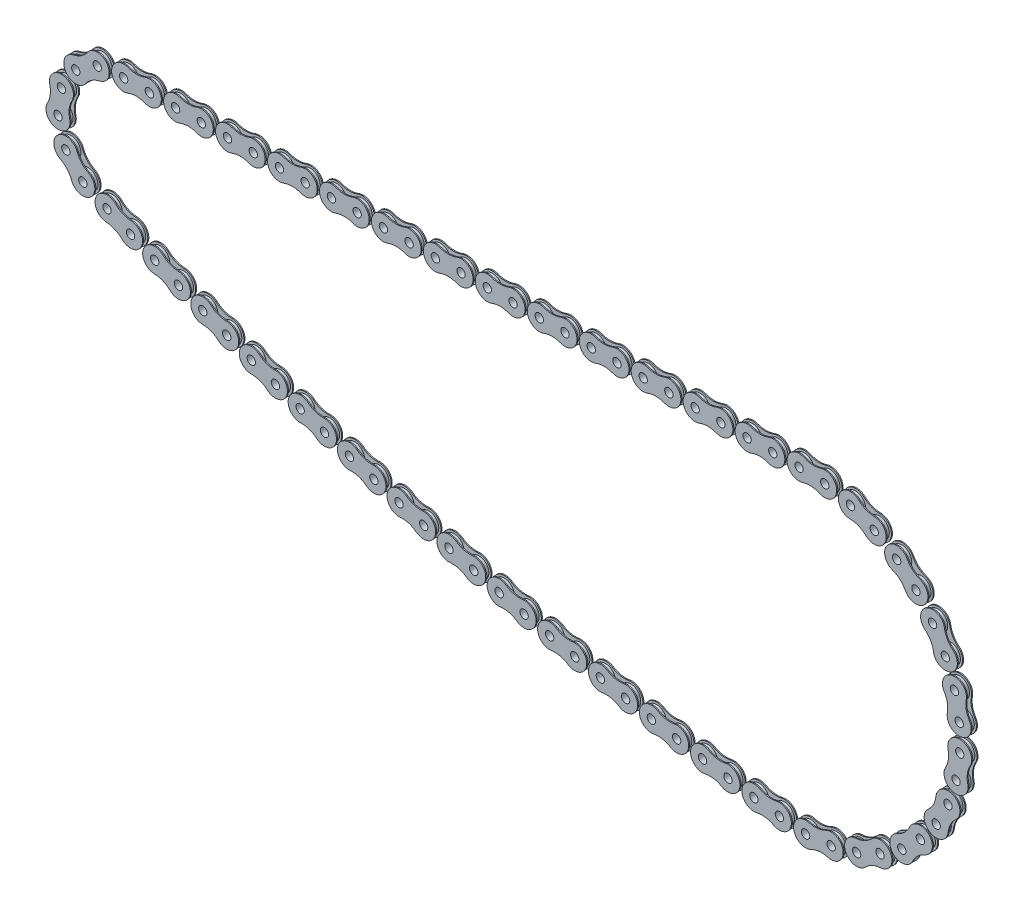
from build123d import *

# Parameters (mm, degrees)
SKETCH1_R             = 4.75
SKETCH1_R_2           = 2
BOSS_EXTRUDE1_DEPTH   = 1
BOSS_EXTRUDE1_2_DEPTH = 1
SKETCH2_R             = 2
BOSS_EXTRUDE2_DEPTH   = 0.5
BOSS_EXTRUDE3_START   = -2.5
SKETCH2_3_R           = 2
BOSS_EXTRUDE3_DEPTH   = 0.5
CRVPATTERN1_5_ANGLE   = 3.3194027
CRVPATTERN1_6_ANGLE   = 22.3179326
CRVPATTERN1_7_ANGLE   = 41.3164626
CRVPATTERN1_8_ANGLE   = 60.3149926
CRVPATTERN1_9_ANGLE   = 79.3135226
CRVPATTERN1_10_ANGLE  = 98.3120525
CRVPATTERN1_11_ANGLE  = 117.3105825
CRVPATTERN1_12_ANGLE  = 136.3091125
CRVPATTERN1_13_ANGLE  = 155.3076425
CRVPATTERN1_14_ANGLE  = 174.3061724
CRVPATTERN1_15_ANGLE  = 172.2361813
CRVPATTERN1_16_ANGLE  = 171.002959
CRVPATTERN1_17_ANGLE  = 169.7697367
CRVPATTERN1_18_ANGLE  = 168.5365143
CRVPATTERN1_19_ANGLE  = 167.303292
CRVPATTERN1_20_ANGLE  = 166.0700697
CRVPATTERN1_21_ANGLE  = 164.8368473
CRVPATTERN1_22_ANGLE  = 163.603625
CRVPATTERN1_23_ANGLE  = 162.3704027
CRVPATTERN1_24_ANGLE  = 161.1371803
CRVPATTERN1_25_ANGLE  = 159.903958
CRVPATTERN1_26_ANGLE  = 158.6707357
CRVPATTERN1_27_ANGLE  = 157.4375133
CRVPATTERN1_28_ANGLE  = 156.204291
CRVPATTERN1_29_ANGLE  = 131.3399051
CRVPATTERN1_30_ANGLE  = 82.3746217
CRVPATTERN1_31_ANGLE  = 33.4093382


with BuildPart() as part:
    # Sketch1 → Boss-Extrude1 (new, symmetric)
    with BuildSketch(Plane.XY):
        with Locations((-6.15, 0)):
            Circle(SKETCH1_R)
        with Locations((-6.15, 0)):
            Circle(SKETCH1_R_2, mode=Mode.SUBTRACT)
    extrude(amount=BOSS_EXTRUDE1_DEPTH, both=True)



with BuildPart() as body_2:
    # Sketch1 → Boss-Extrude1 2 (new, symmetric)
    with BuildSketch(Plane.XY):
        with Locations(Location((6.15, 0, 0), (0, 0, 180))):
            Circle(SKETCH1_R)
        with Locations(Location((6.15, 0, 0), (0, 0, 180))):
            Circle(SKETCH1_R_2, mode=Mode.SUBTRACT)
    extrude(amount=BOSS_EXTRUDE1_2_DEPTH, both=True)


with BuildPart() as part_1:
    add(part.part)

    add(body_2.part)  # Boss-Extrude2 merges body 2
    # Sketch2 → Boss-Extrude2 (add)
    with BuildSketch(Plane.XY.offset(1)):
        with BuildLine():
            ThreePointArc((-4.059362766, 5.356466742), (-11.9, 0), (-4.059362766, -5.356466742))
            ThreePointArc((-4.059362766, -5.356466742), (0, -4.592348401), (4.059362766, -5.356466742))
            ThreePointArc((4.059362766, -5.356466742), (11.9, 0), (4.059362766, 5.356466742))
            ThreePointArc((4.059362766, 5.356466742), (0, 4.592348401), (-4.059362766, 5.356466742))
        make_face()
        with Locations((-6.15, 0)):
            Circle(SKETCH2_R, mode=Mode.SUBTRACT)
        with Locations(Location((6.15, 0, 0), (0, 0, 180))):
            Circle(SKETCH2_R, mode=Mode.SUBTRACT)
    extrude(amount=BOSS_EXTRUDE2_DEPTH)

    # Sketch2<3> → Boss-Extrude3 (add)
    with BuildSketch(Plane.XY.offset(1).offset(BOSS_EXTRUDE3_START)):
        with BuildLine():
            ThreePointArc((-4.059362766, 5.356466742), (-11.9, 0), (-4.059362766, -5.356466742))
            ThreePointArc((-4.059362766, -5.356466742), (0, -4.592348401), (4.059362766, -5.356466742))
            ThreePointArc((4.059362766, -5.356466742), (11.9, 0), (4.059362766, 5.356466742))
            ThreePointArc((4.059362766, 5.356466742), (0, 4.592348401), (-4.059362766, 5.356466742))
        make_face()
        with Locations((-6.15, 0)):
            Circle(SKETCH2_3_R, mode=Mode.SUBTRACT)
        with Locations((6.15, 0)):
            Circle(SKETCH2_3_R, mode=Mode.SUBTRACT)
    extrude(amount=BOSS_EXTRUDE3_DEPTH)


with BuildPart() as body_2_2:
    # CrvPattern1: read off the stored shape, not the designer's step
    # CrvPattern1: copy of part
    add(part_1.part.moved(Location((24.8690176, 0, 0))))


with BuildPart() as body_3:
    # CrvPattern1 2: copy of part
    add(part_1.part.moved(Location((49.7380352, 0, 0))))


with BuildPart() as body_4:
    # CrvPattern1 3: copy of part
    add(part_1.part.moved(Location((74.6070527, 0, 0))))


with BuildPart() as body_5:
    # CrvPattern1 4: copy of part
    add(part_1.part.moved(Location((99.4760703, 0, 0))))


with BuildPart() as body_6:
    # CrvPattern1 5: copy of part
    add(part_1.part.moved(Location((124.1413296, 7.0740823, 0))).rotate(Axis((0, 0, 0), (0, 0, -1)), CRVPATTERN1_5_ANGLE))


with BuildPart() as body_7:
    # CrvPattern1 6: copy of part
    add(part_1.part.moved(Location((139.4918379, 51.1876677, 0))).rotate(Axis((0, 0, 0), (0, 0, -1)), CRVPATTERN1_6_ANGLE))


with BuildPart() as body_8:
    # CrvPattern1 7: copy of part
    add(part_1.part.moved(Location((139.6452484, 97.8955149, 0))).rotate(Axis((0, 0, 0), (0, 0, -1)), CRVPATTERN1_7_ANGLE))


with BuildPart() as body_9:
    # CrvPattern1 8: copy of part
    add(part_1.part.moved(Location((124.5848477, 142.108984, 0))).rotate(Axis((0, 0, 0), (0, 0, -1)), CRVPATTERN1_8_ANGLE))


with BuildPart() as body_10:
    # CrvPattern1 9: copy of part
    add(part_1.part.moved(Location((95.9514083, 179.0111881, 0))).rotate(Axis((0, 0, 0), (0, 0, -1)), CRVPATTERN1_9_ANGLE))


with BuildPart() as body_11:
    # CrvPattern1 10: copy of part
    add(part_1.part.moved(Location((56.864433, 204.5817744, 0))).rotate(Axis((0, 0, 0), (0, 0, -1)), CRVPATTERN1_10_ANGLE))


with BuildPart() as body_12:
    # CrvPattern1 11: copy of part
    add(part_1.part.moved(Location((11.582297, 216.0349262, 0))).rotate(Axis((0, 0, 0), (0, 0, -1)), CRVPATTERN1_11_ANGLE))


with BuildPart() as body_13:
    # CrvPattern1 12: copy of part
    add(part_1.part.moved(Location((-34.9616855, 212.1228666, 0))).rotate(Axis((0, 0, 0), (0, 0, -1)), CRVPATTERN1_12_ANGLE))


with BuildPart() as body_14:
    # CrvPattern1 13: copy of part
    add(part_1.part.moved(Location((-77.6967273, 193.2717996, 0))).rotate(Axis((0, 0, 0), (0, 0, -1)), CRVPATTERN1_13_ANGLE))


with BuildPart() as body_15:
    # CrvPattern1 14: copy of part
    add(part_1.part.moved(Location((-111.9670102, 161.5354761, 0))).rotate(Axis((0, 0, 0), (0, 0, -1)), CRVPATTERN1_14_ANGLE))


with BuildPart() as body_16:
    # CrvPattern1 15: copy of part
    add(part_1.part.moved(Location((-121.7787989, 133.1260574, 0))).rotate(Axis((0, 0, 0), (0, 0, 1)), CRVPATTERN1_15_ANGLE))


with BuildPart() as body_17:
    # CrvPattern1 16: copy of part
    add(part_1.part.moved(Location((-99.7486502, 130.7419102, 0))).rotate(Axis((0, 0, 0), (0, 0, 1)), CRVPATTERN1_16_ANGLE))


with BuildPart() as body_18:
    # CrvPattern1 17: copy of part
    add(part_1.part.moved(Location((-77.6722923, 128.8324509, 0))).rotate(Axis((0, 0, 0), (0, 0, 1)), CRVPATTERN1_17_ANGLE))


with BuildPart() as body_19:
    # CrvPattern1 18: copy of part
    add(part_1.part.moved(Location((-55.5599524, 127.3985641, 0))).rotate(Axis((0, 0, 0), (0, 0, 1)), CRVPATTERN1_18_ANGLE))


with BuildPart() as body_20:
    # CrvPattern1 19: copy of part
    add(part_1.part.moved(Location((-33.4218739, 126.4409141, 0))).rotate(Axis((0, 0, 0), (0, 0, 1)), CRVPATTERN1_19_ANGLE))


with BuildPart() as body_21:
    # CrvPattern1 20: copy of part
    add(part_1.part.moved(Location((-11.2683126, 125.9599444, 0))).rotate(Axis((0, 0, 0), (0, 0, 1)), CRVPATTERN1_20_ANGLE))


with BuildPart() as body_22:
    # CrvPattern1 21: copy of part
    add(part_1.part.moved(Location((10.8904688, 125.9558779, 0))).rotate(Axis((0, 0, 0), (0, 0, 1)), CRVPATTERN1_21_ANGLE))


with BuildPart() as body_23:
    # CrvPattern1 22: copy of part
    add(part_1.part.moved(Location((33.0442051, 126.4287165, 0))).rotate(Axis((0, 0, 0), (0, 0, 1)), CRVPATTERN1_22_ANGLE))


with BuildPart() as body_24:
    # CrvPattern1 23: copy of part
    add(part_1.part.moved(Location((55.1826335, 127.3782412, 0))).rotate(Axis((0, 0, 0), (0, 0, 1)), CRVPATTERN1_23_ANGLE))


with BuildPart() as body_25:
    # CrvPattern1 24: copy of part
    add(part_1.part.moved(Location((77.2954983, 128.804012, 0))).rotate(Axis((0, 0, 0), (0, 0, 1)), CRVPATTERN1_24_ANGLE))


with BuildPart() as body_26:
    # CrvPattern1 25: copy of part
    add(part_1.part.moved(Location((99.3725555, 130.7053684, 0))).rotate(Axis((0, 0, 0), (0, 0, 1)), CRVPATTERN1_25_ANGLE))


with BuildPart() as body_27:
    # CrvPattern1 26: copy of part
    add(part_1.part.moved(Location((121.4035777, 133.0814297, 0))).rotate(Axis((0, 0, 0), (0, 0, 1)), CRVPATTERN1_26_ANGLE))


with BuildPart() as body_28:
    # CrvPattern1 27: copy of part
    add(part_1.part.moved(Location((143.3783591, 135.9310952, 0))).rotate(Axis((0, 0, 0), (0, 0, 1)), CRVPATTERN1_27_ANGLE))


with BuildPart() as body_29:
    # CrvPattern1 28: copy of part
    add(part_1.part.moved(Location((165.2867197, 139.2530446, 0))).rotate(Axis((0, 0, 0), (0, 0, 1)), CRVPATTERN1_28_ANGLE))


with BuildPart() as body_30:
    # CrvPattern1 29: copy of part
    add(part_1.part.moved(Location((114.7830297, 203.6272837, 0))).rotate(Axis((0, 0, 0), (0, 0, 1)), CRVPATTERN1_29_ANGLE))


with BuildPart() as body_31:
    # CrvPattern1 30: copy of part
    add(part_1.part.moved(Location((-56.2910925, 230.2621971, 0))).rotate(Axis((0, 0, 0), (0, 0, 1)), CRVPATTERN1_30_ANGLE))


with BuildPart() as body_32:
    # CrvPattern1 31: copy of part
    add(part_1.part.moved(Location((-188.695058, 118.7051992, 0))).rotate(Axis((0, 0, 0), (0, 0, 1)), CRVPATTERN1_31_ANGLE))


with BuildPart() as body_33:
    # CrvPattern1 32: copy of part
    add(part_1.part.moved(Location((-198.9521407, 0, 0))))


with BuildPart() as body_34:
    # CrvPattern1 33: copy of part
    add(part_1.part.moved(Location((-174.0831231, 0, 0))))


with BuildPart() as body_35:
    # CrvPattern1 34: copy of part
    add(part_1.part.moved(Location((-149.2141055, 0, 0))))


with BuildPart() as body_36:
    # CrvPattern1 35: copy of part
    add(part_1.part.moved(Location((-124.3450879, 0, 0))))


with BuildPart() as body_37:
    # CrvPattern1 36: copy of part
    add(part_1.part.moved(Location((-99.4760703, 0, 0))))


with BuildPart() as body_38:
    # CrvPattern1 37: copy of part
    add(part_1.part.moved(Location((-74.6070527, 0, 0))))


with BuildPart() as body_39:
    # CrvPattern1 38: copy of part
    add(part_1.part.moved(Location((-49.7380352, 0, 0))))


with BuildPart() as body_40:
    # CrvPattern1 39: copy of part
    add(part_1.part.moved(Location((-24.8690176, 0, 0))))


solid = Compound([part_1.part, body_2_2.part, body_3.part, body_4.part, body_5.part, body_6.part, body_7.part, body_8.part, body_9.part, body_10.part, body_11.part, body_12.part, body_13.part, body_14.part, body_15.part, body_16.part, body_17.part, body_18.part, body_19.part, body_20.part, body_21.part, body_22.part, body_23.part, body_24.part, body_25.part, body_26.part, body_27.part, body_28.part, body_29.part, body_30.part, body_31.part, body_32.part, body_33.part, body_34.part, body_35.part, body_36.part, body_37.part, body_38.part, body_39.part, body_40.part])
